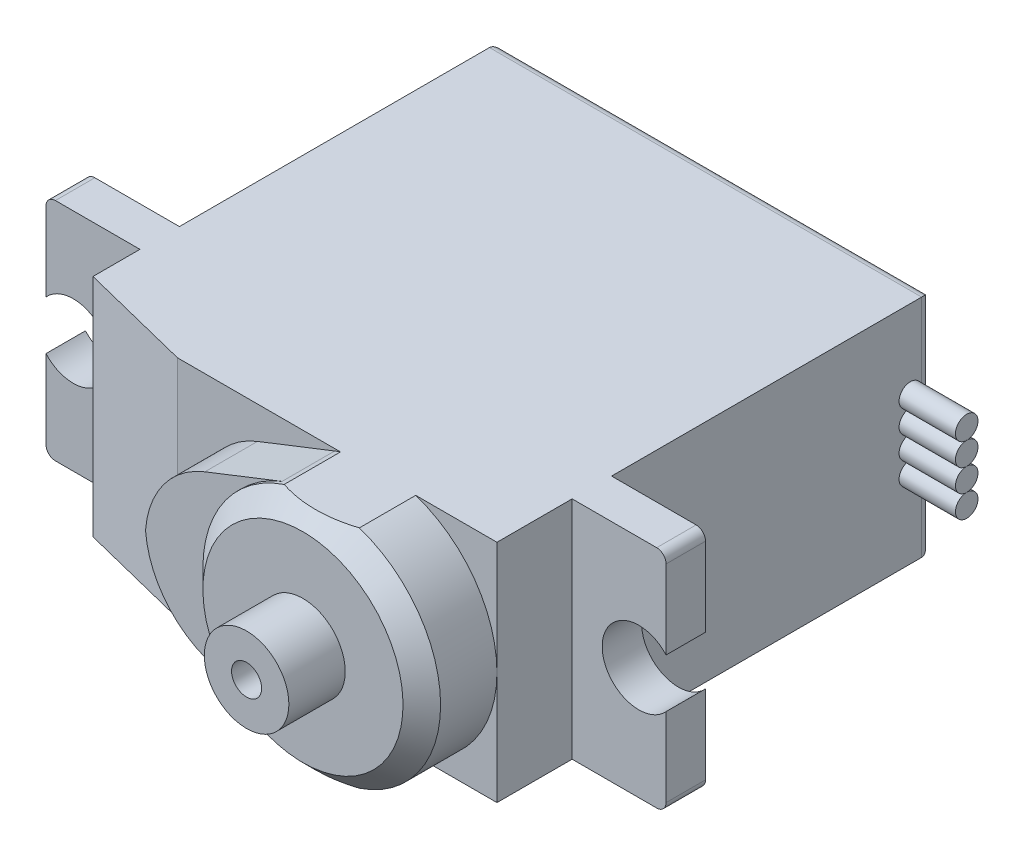
from build123d import *

# Parameters (mm, degrees)
ESQUISSE1_W             = 23
ESQUISSE1_H             = 12
BOSS_EXTRU_1_DEPTH      = 17
BOSS_EXTRU_2_DEPTH      = 2.1
ESQUISSE3_W             = 23
ESQUISSE3_H             = 12
BOSS_EXTRU_3_DEPTH      = 4
CONG_1_R                = 0.5
BOSS_EXTRU_4_DEPTH      = 4
CHANFREIN1_SIZE         = 1
ENL_V_MAT_EXTRU_1_DEPTH = 34.921379689
BOSS_EXTRU_5_DEPTH      = 2.8
ESQUISSE8_R             = 2.25
ESQUISSE8_R_2           = 0.8
BOSS_EXTRU_6_DEPTH      = 3
ESQUISSE9_R             = 0.6
BOSS_EXTRU_7_DEPTH      = 3
BOSS_EXTRU_7_2_DEPTH    = 3
BOSS_EXTRU_7_3_DEPTH    = 3
BOSS_EXTRU_7_4_DEPTH    = 3


with BuildPart() as part:
    # Esquisse1 → Boss.-Extru.1 (new body)
    with BuildSketch(Plane.XY):
        Rectangle(ESQUISSE1_W, ESQUISSE1_H)
    extrude(amount=BOSS_EXTRU_1_DEPTH)

    # Esquisse2 → Boss.-Extru.2 (add)
    with BuildSketch(Plane.XY.offset(17)):
        with BuildLine():
            Line((-16, 6), (16, 6))
            ThreePointArc((16, 6), (16.353553391, 5.853553391), (16.5, 5.5))
            Line((16.5, 5.5), (16.5, 1.303840481))
            ThreePointArc((16.5, 1.303840481), (13.1, 0), (16.5, -1.303840481))
            Line((16.5, -1.303840481), (16.5, -5.5))
            ThreePointArc((16.5, -5.5), (16.353553391, -5.853553391), (16, -6))
            Line((16, -6), (-16, -6))
            ThreePointArc((-16, -6), (-16.353553391, -5.853553391), (-16.5, -5.5))
            Line((-16.5, -5.5), (-16.5, -1.303840481))
            ThreePointArc((-16.5, -1.303840481), (-13.1, 0), (-16.5, 1.303840481))
            Line((-16.5, 1.303840481), (-16.5, 5.5))
            ThreePointArc((-16.5, 5.5), (-16.353553391, 5.853553391), (-16, 6))
        make_face()
    extrude(amount=BOSS_EXTRU_2_DEPTH)

    # Esquisse3 → Boss.-Extru.3 (add)
    with BuildSketch(Plane.XY.offset(19.1)):
        Rectangle(ESQUISSE3_W, ESQUISSE3_H)
    extrude(amount=BOSS_EXTRU_3_DEPTH)

    # Congé1
    cong_1_edges = [part.edges().sort_by_distance(p)[0] for p in [
        (0, -6, 0),
        (-11.5, 0, 0),
        (0, 6, 0),
        (11.5, 0, 0),
    ]]
    fillet(cong_1_edges, radius=CONG_1_R)

    # Esquisse5 → Boss.-Extru.4 (add)
    with BuildSketch(Plane.XY.offset(23.1)):
        with BuildLine():
            Line((3.173594244, 6), (7.176405756, 6))
            ThreePointArc((7.176405756, 6), (11.5, 0), (7.176405756, -6))
            Line((7.176405756, -6), (3.173594244, -6))
            ThreePointArc((3.173594244, -6), (-1.15, 0), (3.173594244, 6))
        make_face()
    extrude(amount=BOSS_EXTRU_4_DEPTH)

    # Chanfrein1
    # the kernel refuses this chamfer: 1 mm, written as the material it takes off along each edge
    with BuildSketch(Plane(origin=(5.175, 0, 27.1), x_dir=(0.08493945203394825, -0.9963861146604627, 0), z_dir=(0.9963861146604627, 0.08493945203394825, 0))) as chanfrein1_piece_1:
        Polygon((6.325, CHANFREIN1_SIZE), (6.325 - CHANFREIN1_SIZE, 0), (6.325, 0), align=None)
    revolve(axis=Axis((5.175, 0, 27.1), (0, 0, -1)), revolution_arc=189.74508627, mode=Mode.SUBTRACT)
    with BuildSketch(Plane(origin=(5.175, 0, 27.1), x_dir=(-0.08493945203394813, 0.9963861146604627, 0), z_dir=(-0.9963861146604627, -0.08493945203394813, 0))) as chanfrein1_piece_2:
        Polygon((6.325, CHANFREIN1_SIZE), (6.325 - CHANFREIN1_SIZE, 0), (6.325, 0), align=None)
    revolve(axis=Axis((5.175, 0, 27.1), (0, 0, -1)), revolution_arc=189.74508627, mode=Mode.SUBTRACT)

    # Esquisse6 → Enlèv. mat.-Extru.1 (cut, through all)
    with BuildSketch(Plane.XZ.offset(6)):
        Polygon((-11.5, 21.6), (-5.5, 23.1), (-11.5, 23.1), align=None)
    extrude(amount=-ENL_V_MAT_EXTRU_1_DEPTH, mode=Mode.SUBTRACT)

    # Esquisse7 → Boss.-Extru.5 (add)
    with BuildSketch(Plane.XY.offset(23.1)):
        with BuildLine():
            Line((-1.244498087, -4.275128639), (2.864099339, -5.88772988))
            ThreePointArc((2.864099339, -5.88772988), (-1.15, 0), (2.864099339, 5.88772988))
            Line((2.864099339, 5.88772988), (-1.244498087, 4.275128639))
            ThreePointArc((-1.244498087, 4.275128639), (-3.439063989, 2.592096904), (-4.403298896, 0))
            ThreePointArc((-4.403298896, 0), (-3.439063989, -2.592096904), (-1.244498087, -4.275128639))
        make_face()
    extrude(amount=BOSS_EXTRU_5_DEPTH)


with BuildPart() as body_2:
    # Esquisse8 → Boss.-Extru.6 (new body)
    with BuildSketch(Plane.XY.offset(27.1)):
        with Locations((5.175, 0)):
            Circle(ESQUISSE8_R)
        with Locations((5.175, 0)):
            Circle(ESQUISSE8_R_2, mode=Mode.SUBTRACT)
    extrude(amount=BOSS_EXTRU_6_DEPTH)


with BuildPart() as body_3:
    # Esquisse9 → Boss.-Extru.7 (new body)
    with BuildSketch(Plane(origin=(11.5, 0, 0), x_dir=(0, 0, -1), z_dir=(1, 0, 0))):
        with Locations((-1.1, 1.8)):
            Circle(ESQUISSE9_R)
    extrude(amount=BOSS_EXTRU_7_DEPTH)


with BuildPart() as body_4:
    # Esquisse9 → Boss.-Extru.7 2 (new body)
    with BuildSketch(Plane(origin=(11.5, 0, 0), x_dir=(0, 0, -1), z_dir=(1, 0, 0))):
        with Locations((-1.1, 0.6)):
            Circle(ESQUISSE9_R)
    extrude(amount=BOSS_EXTRU_7_2_DEPTH)


with BuildPart() as body_5:
    # Esquisse9 → Boss.-Extru.7 3 (new body)
    with BuildSketch(Plane(origin=(11.5, 0, 0), x_dir=(0, 0, -1), z_dir=(1, 0, 0))):
        with Locations((-1.1, -0.6)):
            Circle(ESQUISSE9_R)
    extrude(amount=BOSS_EXTRU_7_3_DEPTH)


with BuildPart() as body_6:
    # Esquisse9 → Boss.-Extru.7 4 (new body)
    with BuildSketch(Plane(origin=(11.5, 0, 0), x_dir=(0, 0, -1), z_dir=(1, 0, 0))):
        with Locations((-1.1, -1.8)):
            Circle(ESQUISSE9_R)
    extrude(amount=BOSS_EXTRU_7_4_DEPTH)


solid = Compound([part.part, body_2.part, body_3.part, body_4.part, body_5.part, body_6.part])
